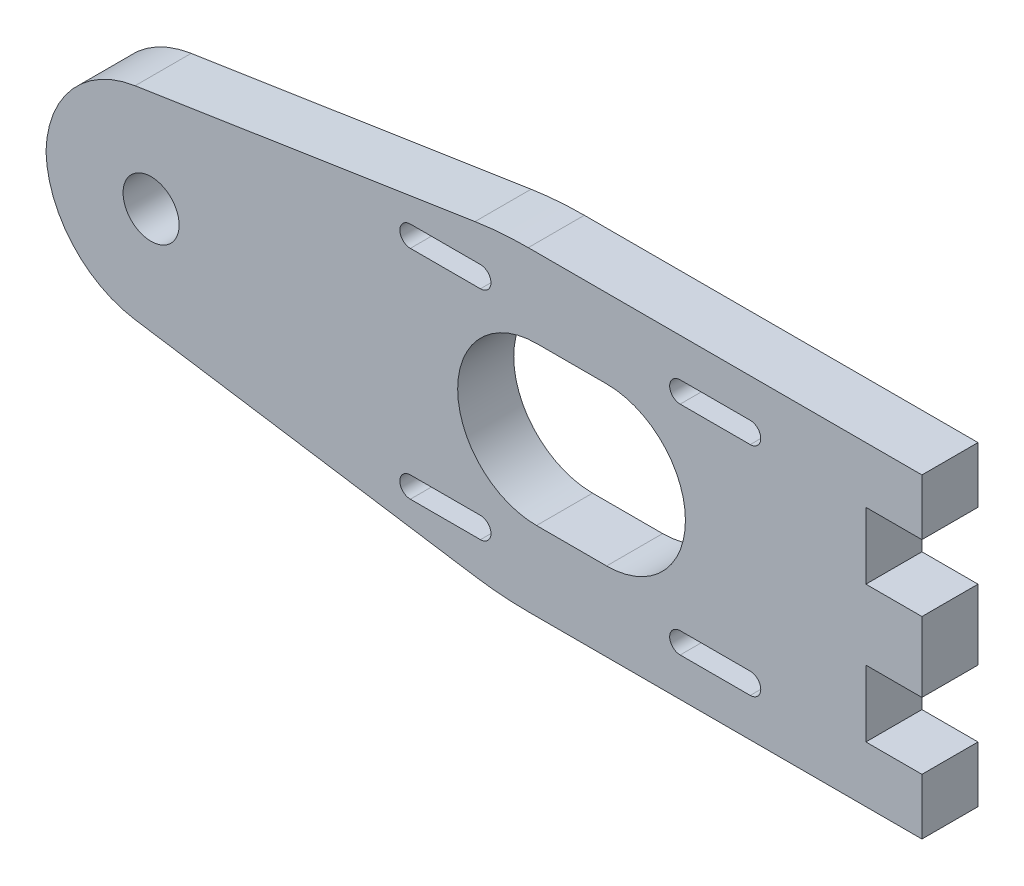
from build123d import *

# Parameters (mm, degrees)
BOSS_EXTRUDE1_DEPTH = 8
CHAMFER1_SIZE       = 10
CHAMFER1_SIZE2      = 65
CHAMFER2_SIZE       = 65
CHAMFER2_SIZE2      = 10
FILLET2_R           = 15
FILLET3_R           = 50
SKETCH2_R           = 4
CUT_EXTRUDE1_DEPTH  = 80
CUT_EXTRUDE2_DEPTH  = 8


with BuildPart() as part:
    # Sketch1 → Boss-Extrude1 (new body)
    with BuildSketch(Plane.XY):
        Polygon((0, 17.5), (0, 27.5), (-8, 27.5), (-8, 37), (0, 37), (0, 45), (-125, 45), (-125, 22.5), (-125, 0), (0, 0), (0, 8), (-8, 8), (-8, 17.5), align=None)
    extrude(amount=BOSS_EXTRUDE1_DEPTH)

    # Chamfer1
    chamfer1_edges = [part.edges().sort_by_distance(p)[0] for p in [
        (-125, 0, 4),
    ]]
    chamfer1_side = [part.faces().sort_by_distance(p)[0] for p in [
        (-125, 22.5, 4),
    ]]
    chamfer(chamfer1_edges, length=CHAMFER1_SIZE, length2=CHAMFER1_SIZE2, reference=chamfer1_side[0])

    # Chamfer2
    chamfer2_edges = [part.edges().sort_by_distance(p)[0] for p in [
        (-125, 45, 4),
    ]]
    chamfer2_side = [part.faces().sort_by_distance(p)[0] for p in [
        (-62.5, 45, 4),
    ]]
    chamfer(chamfer2_edges, length=CHAMFER2_SIZE, length2=CHAMFER2_SIZE2, reference=chamfer2_side[0])

    # Fillet2
    # the kernel refuses this fillet: 15 mm, written as the material it takes off along each edge
    with BuildSketch(Plane(origin=(-125, 10, -32.171960879), x_dir=(0, 1, 0), z_dir=(0, 0, 1))) as fillet2_piece_1:
        with BuildLine():
            CenterArc((FILLET2_R * 0.857918956767, -FILLET2_R), FILLET2_R, 90, 81.253837737)
            Line((-FILLET2_R * 0.130452740884, -FILLET2_R * 0.847942815746), (0, 0))
            Line((0, 0), (FILLET2_R * 0.857918956767, 0))
        make_face()
    extrude(amount=72.343921757, mode=Mode.SUBTRACT)
    with BuildSketch(Plane(origin=(-125, 35, -32.171960879), x_dir=(0, -1, 0), z_dir=(0, 0, 1))) as fillet2_piece_2:
        with BuildLine():
            CenterArc((FILLET2_R * 0.857918956767, FILLET2_R), FILLET2_R, 188.746162263, 81.253837737)
            Line((-FILLET2_R * 0.130452740884, FILLET2_R * 0.847942815746), (0, 0))
            Line((0, 0), (FILLET2_R * 0.857918956767, 0))
        make_face()
    extrude(amount=72.343921757, mode=Mode.SUBTRACT)

    # Fillet3
    fillet3_edges = [part.edges().sort_by_distance(p)[0] for p in [
        (-60, 0, 4),
        (-60, 45, 4),
    ]]
    fillet(fillet3_edges, radius=FILLET3_R)

    # Sketch2 → Cut-Extrude1 (cut)
    with BuildSketch(Plane.XY.offset(8)):
        with Locations((-110, 22.868784351)):
            Circle(SKETCH2_R)
    extrude(amount=-CUT_EXTRUDE1_DEPTH, mode=Mode.SUBTRACT)

    # Sketch3 → Cut-Extrude2 (cut)
    with BuildSketch(Plane.XY.offset(8)):
        with BuildLine():
            Line((-73, 5.5), (-63, 5.5))
            ThreePointArc((-63, 5.5), (-61.5, 7), (-63, 8.5))
            Line((-63, 8.5), (-73, 8.5))
            ThreePointArc((-73, 8.5), (-74.5, 7), (-73, 5.5))
        make_face()
        with BuildLine():
            Line((-73, 36.5), (-63, 36.5))
            ThreePointArc((-63, 36.5), (-61.5, 38), (-63, 39.5))
            Line((-63, 39.5), (-73, 39.5))
            ThreePointArc((-73, 39.5), (-74.5, 38), (-73, 36.5))
        make_face()
        with BuildLine():
            ThreePointArc((-45, 11.25), (-37.045048712, 14.545048712), (-33.75, 22.5))
            Line((-33.75, 22.5), (-50, 22.5))
            Line((-50, 22.5), (-50, 33.75))
            Line((-50, 33.75), (-55, 33.75))
            ThreePointArc((-55, 33.75), (-66.25, 22.5), (-55, 11.25))
            Line((-55, 11.25), (-45, 11.25))
        make_face()
        with BuildLine():
            Line((-50, 22.5), (-33.75, 22.5))
            ThreePointArc((-33.75, 22.5), (-37.045048712, 30.454951288), (-45, 33.75))
            Line((-45, 33.75), (-50, 33.75))
            Line((-50, 33.75), (-50, 22.5))
        make_face()
        with BuildLine():
            Line((-34.5, 36.5), (-24.5, 36.5))
            ThreePointArc((-24.5, 36.5), (-23, 38), (-24.5, 39.5))
            Line((-24.5, 39.5), (-34.5, 39.5))
            ThreePointArc((-34.5, 39.5), (-36, 38), (-34.5, 36.5))
        make_face()
        with BuildLine():
            Line((-34.5, 5.5), (-24.5, 5.5))
            ThreePointArc((-24.5, 5.5), (-23, 7), (-24.5, 8.5))
            Line((-24.5, 8.5), (-34.5, 8.5))
            ThreePointArc((-34.5, 8.5), (-36, 7), (-34.5, 5.5))
        make_face()
    extrude(amount=-CUT_EXTRUDE2_DEPTH, mode=Mode.SUBTRACT)


solid = part.part
